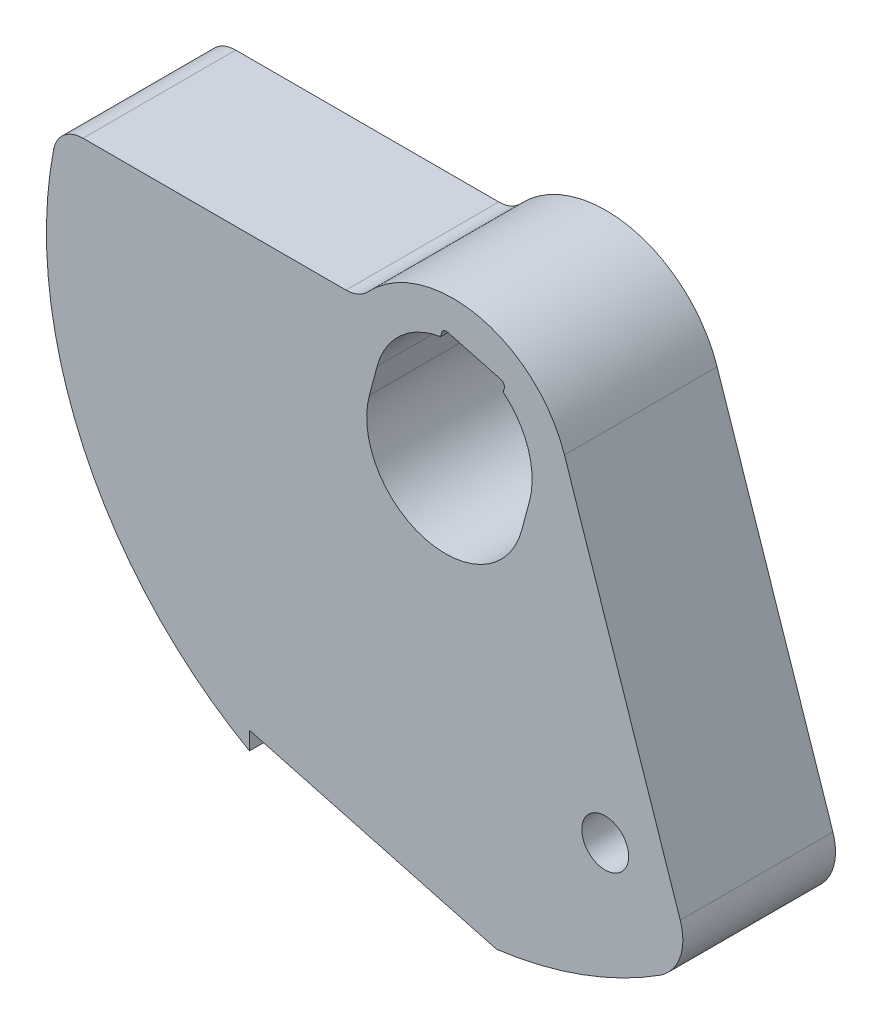
from build123d import *

# Parameters (mm, degrees)
SKETCH1_R               = 1.1938
BOSS_EXTRUDE1_DEPTH     = 7.7724
CUT_EXTRUDE1_DEPTH      = 30.656212081
CUT_EXTRUDE1_DEPTH_BACK = 30.656212081
FILLET1_R               = 2.54


with BuildPart() as part:
    # Sketch1 → Boss-Extrude1 (new body)
    with BuildSketch(Plane.XY):
        with BuildLine():
            ThreePointArc((-3.95481445, 5.560217822), (-4.460344292, 5.205196933), (-5.065262452, 5.08))
            Line((-5.065262452, 5.08), (-18.456556559, 5.08))
            ThreePointArc((-18.456556559, 5.08), (-19.426909517, 4.731155792), (-19.953034117, 3.844324324))
            ThreePointArc((-19.953034117, 3.844324324), (-18.44069754, -8.534815418), (-9.9822, -17.699098371))
            Line((-9.9822, -17.699098371), (-9.9822, -16.784328658))
            Line((-9.9822, -16.784328658), (2.593084415, -20.153865962))
            ThreePointArc((2.593084415, -20.153865962), (10.900004065, -17.149119843), (17.146958643, -10.903403565))
            Line((17.146958643, -10.903403565), (12.940315476, -3.61728387))
            ThreePointArc((12.940315476, -3.61728387), (12.796393961, -3.475289825), (12.60008731, -3.426922378))
            ThreePointArc((12.60008731, -3.426922378), (9.17217903, -2.398369889), (7.028137334, 0.467212181))
            Line((7.028137334, 0.467212181), (6.053096787, 3.371693793))
            ThreePointArc((6.053096787, 3.371693793), (1.669604011, 7.303273092), (-3.95481445, 5.560217822))
        make_face()
        with Locations((8.128, -12.7)):
            Circle(SKETCH1_R, mode=Mode.SUBTRACT)
        with BuildLine():
            ThreePointArc((3.876453526, -1.038692592), (-1.038692592, -3.876453526), (-3.876453526, 1.038692592))
            Line((-3.876453526, 1.038692592), (-3.482013301, 2.510763551))
            ThreePointArc((-3.482013301, 2.510763551), (-2.298514325, 4.447599489), (-0.253578298, 5.432607064))
            Line((-0.253578298, 5.432607064), (-0.201054745, 5.628627633))
            ThreePointArc((-0.201054745, 5.628627633), (-0.082709585, 5.782858048), (0.110030452, 5.808232755))
            Line((0.110030452, 5.808232755), (2.808827211, 5.085092343))
            ThreePointArc((2.808827211, 5.085092343), (2.963057626, 4.966747183), (2.988432333, 4.774007146))
            Line((2.988432333, 4.774007146), (2.93590878, 4.577986577))
            ThreePointArc((2.93590878, 4.577986577), (4.214371541, 2.702476981), (4.270893751, 0.433378367))
            Line((4.270893751, 0.433378367), (3.876453526, -1.038692592))
        make_face(mode=Mode.SUBTRACT)
    extrude(amount=-BOSS_EXTRUDE1_DEPTH)

    # Sketch2 → Cut-Extrude1 (cut, two sides: drawn at the far end of the back side and taken through both)
    with BuildSketch(Plane.XY.offset(-CUT_EXTRUDE1_DEPTH_BACK)):
        Polygon((-21.844195139, 86.473029104), (7.028137334, 0.467212181), (12.549933302, -15.98128825), (41.422265775, -101.987105173), (213.433899622, -44.242440226), (150.167438707, 144.217694051), align=None)
    extrude(amount=CUT_EXTRUDE1_DEPTH + CUT_EXTRUDE1_DEPTH_BACK, mode=Mode.SUBTRACT)

    # Fillet1
    fillet1_edges = [part.edges().sort_by_distance(p)[0] for p in [
        (12.549933302, -15.98128825, -3.8862),
    ]]
    fillet(fillet1_edges, radius=FILLET1_R)


solid = part.part
